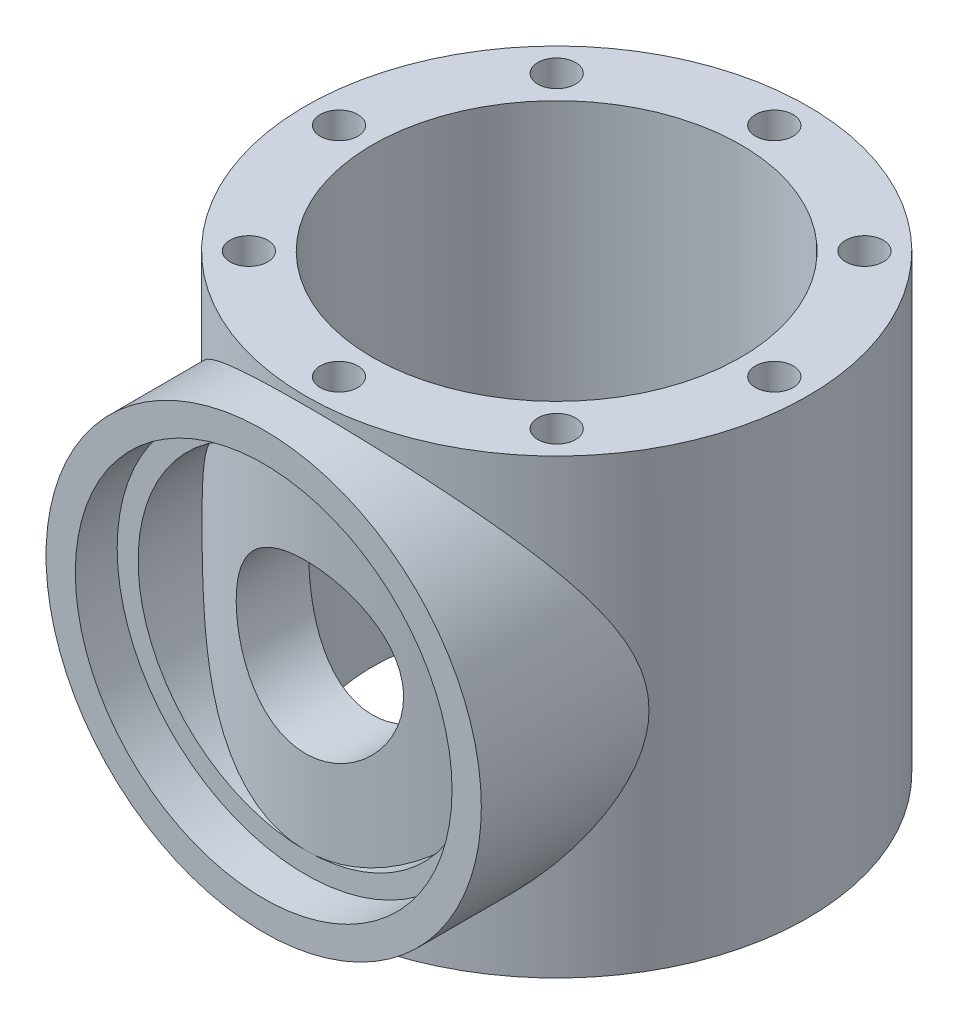
from build123d import *

# Parameters (mm, degrees)
SKETCH_1_R                 = 30
SKETCH_1_R_2               = 22
EXTRUDE_1_DEPTH            = 54
HOLE_WIZARD_M41_AT_2_COUNT = 2
HOLE_WIZARD_M41_AT_2_PITCH = 19.899538483
HOLE_WIZARD_M41_AT_3_COUNT = 2
HOLE_WIZARD_M41_AT_3_PITCH = 36.769552622
HOLE_WIZARD_M41_AT_4_COUNT = 2
HOLE_WIZARD_M41_AT_4_PITCH = 48.041735691
HOLE_WIZARD_M41_AT_5_COUNT = 2
HOLE_WIZARD_M41_AT_5_PITCH = 52
HOLE_WIZARD_M41_AT_6_COUNT = 2
HOLE_WIZARD_M41_AT_6_PITCH = 48.041735691
HOLE_WIZARD_M41_AT_7_COUNT = 2
HOLE_WIZARD_M41_AT_7_PITCH = 36.769552622
HOLE_WIZARD_M41_AT_8_COUNT = 2
HOLE_WIZARD_M41_AT_8_PITCH = 19.899538483
EXTRUDE_2_REACH            = 91.672
SKETCH_7_R                 = 26
SKETCH_7_R_2               = 20
SKETCH_9_R                 = 22.5
CUT_EXTRUDE_3_DEPTH        = 5
SKETCH_10_R                = 10
CUT_EXTRUDE_4_DEPTH        = 15


with BuildPart() as part:
    # Эскиз1 → Бобышка-Вытянуть1 (new body)
    with BuildSketch(Plane(origin=(0, 0, 0), x_dir=(1, 0, 0), z_dir=(0, 1, 0))):
        Circle(SKETCH_1_R)
        Circle(SKETCH_1_R_2, mode=Mode.SUBTRACT)
    extrude(amount=EXTRUDE_1_DEPTH)

    # Эскиз5 → Отверстие с зазором M41 (revolve, cut)
    with BuildSketch(Plane(origin=(-18.384776311, 54, -18.384776311), x_dir=(0, 0, 1), z_dir=(1, 0, 0))):
        Polygon((0, 0), (0, 13.351936393), (2.25, 12), (2.25, 0), align=None)
    hole_wizard_m41 = revolve(axis=Axis((-18.384776311, 60.35, -18.384776311), (0, -1, 0)), mode=Mode.SUBTRACT)

    # Отверстие с зазором M41 at 2: Отверстие с зазором M41 ×2
    with Locations(*[Vector(0.9238795325112705, 0, -0.38268343236512914) * (i * HOLE_WIZARD_M41_AT_2_PITCH) for i in range(1, HOLE_WIZARD_M41_AT_2_COUNT)]):
        add(hole_wizard_m41, mode=Mode.SUBTRACT)

    # Отверстие с зазором M41 at 3: Отверстие с зазором M41 ×2
    with Locations(*[(i * HOLE_WIZARD_M41_AT_3_PITCH, 0, 0) for i in range(1, HOLE_WIZARD_M41_AT_3_COUNT)]):
        add(hole_wizard_m41, mode=Mode.SUBTRACT)

    # Отверстие с зазором M41 at 4: Отверстие с зазором M41 ×2
    with Locations(*[Vector(0.9238795325113031, 0, 0.3826834323650504) * (i * HOLE_WIZARD_M41_AT_4_PITCH) for i in range(1, HOLE_WIZARD_M41_AT_4_COUNT)]):
        add(hole_wizard_m41, mode=Mode.SUBTRACT)

    # Отверстие с зазором M41 at 5: Отверстие с зазором M41 ×2
    with Locations(*[Vector(0.7071067811865778, 0, 0.7071067811865174) * (i * HOLE_WIZARD_M41_AT_5_PITCH) for i in range(1, HOLE_WIZARD_M41_AT_5_COUNT)]):
        add(hole_wizard_m41, mode=Mode.SUBTRACT)

    # Отверстие с зазором M41 at 6: Отверстие с зазором M41 ×2
    with Locations(*[Vector(0.38268343236512914, 0, 0.9238795325112705) * (i * HOLE_WIZARD_M41_AT_6_PITCH) for i in range(1, HOLE_WIZARD_M41_AT_6_COUNT)]):
        add(hole_wizard_m41, mode=Mode.SUBTRACT)

    # Отверстие с зазором M41 at 7: Отверстие с зазором M41 ×2
    with Locations(*[(0, 0, i * HOLE_WIZARD_M41_AT_7_PITCH) for i in range(1, HOLE_WIZARD_M41_AT_7_COUNT)]):
        add(hole_wizard_m41, mode=Mode.SUBTRACT)

    # Отверстие с зазором M41 at 8: Отверстие с зазором M41 ×2
    with Locations(*[Vector(-0.3826834323650503, 0, 0.9238795325113031) * (i * HOLE_WIZARD_M41_AT_8_PITCH) for i in range(1, HOLE_WIZARD_M41_AT_8_COUNT)]):
        add(hole_wizard_m41, mode=Mode.SUBTRACT)

    # Зеркальное отражение1: Отверстие с зазором M41 across plane
    add(hole_wizard_m41.mirror(Plane.ZX.offset(27)), mode=Mode.SUBTRACT)

    # Зеркальное отражение1 copy 1 sketch → Зеркальное отражение1 copy 1 (revolve, cut)
    with BuildSketch(Plane(origin=(0, 0, -26), x_dir=(0, 0, 1), z_dir=(1, 0, 0))):
        Polygon((0, 0), (0, -13.351936393), (2.25, -12), (2.25, 0), align=None)
    revolve(axis=Axis((0, -6.35, -26), (0, -1, 0)), mode=Mode.SUBTRACT)

    # Зеркальное отражение1 copy 2 sketch → Зеркальное отражение1 copy 2 (revolve, cut)
    with BuildSketch(Plane(origin=(18.384776311, 0, -18.384776311), x_dir=(0, 0, 1), z_dir=(1, 0, 0))):
        Polygon((0, 0), (0, -13.351936393), (2.25, -12), (2.25, 0), align=None)
    revolve(axis=Axis((18.384776311, -6.35, -18.384776311), (0, -1, 0)), mode=Mode.SUBTRACT)

    # Зеркальное отражение1 copy 3 sketch → Зеркальное отражение1 copy 3 (revolve, cut)
    with BuildSketch(Plane(origin=(26, 0, 0), x_dir=(0, 0, 1), z_dir=(1, 0, 0))):
        Polygon((0, 0), (0, -13.351936393), (2.25, -12), (2.25, 0), align=None)
    revolve(axis=Axis((26, -6.35, 0), (0, -1, 0)), mode=Mode.SUBTRACT)

    # Зеркальное отражение1 copy 4 sketch → Зеркальное отражение1 copy 4 (revolve, cut)
    with BuildSketch(Plane(origin=(18.384776311, 0, 18.384776311), x_dir=(0, 0, 1), z_dir=(1, 0, 0))):
        Polygon((0, 0), (0, -13.351936393), (2.25, -12), (2.25, 0), align=None)
    revolve(axis=Axis((18.384776311, -6.35, 18.384776311), (0, -1, 0)), mode=Mode.SUBTRACT)

    # Зеркальное отражение1 copy 5 sketch → Зеркальное отражение1 copy 5 (revolve, cut)
    with BuildSketch(Plane(origin=(0, 0, 26), x_dir=(0, 0, 1), z_dir=(1, 0, 0))):
        Polygon((0, 0), (0, -13.351936393), (2.25, -12), (2.25, 0), align=None)
    revolve(axis=Axis((0, -6.35, 26), (0, -1, 0)), mode=Mode.SUBTRACT)

    # Зеркальное отражение1 copy 6 sketch → Зеркальное отражение1 copy 6 (revolve, cut)
    with BuildSketch(Plane(origin=(-18.384776311, 0, 18.384776311), x_dir=(0, 0, 1), z_dir=(1, 0, 0))):
        Polygon((0, 0), (0, -13.351936393), (2.25, -12), (2.25, 0), align=None)
    revolve(axis=Axis((-18.384776311, -6.35, 18.384776311), (0, -1, 0)), mode=Mode.SUBTRACT)

    # Зеркальное отражение1 copy 7 sketch → Зеркальное отражение1 copy 7 (revolve, cut)
    with BuildSketch(Plane(origin=(-26, 0, 0), x_dir=(0, 0, 1), z_dir=(1, 0, 0))):
        Polygon((0, 0), (0, -13.351936393), (2.25, -12), (2.25, 0), align=None)
    revolve(axis=Axis((-26, -6.35, 0), (0, -1, 0)), mode=Mode.SUBTRACT)

    # Эскиз7 → Бобышка-Вытянуть2 (add, up to next)
    with BuildSketch(Plane.XY.offset(35), mode=Mode.PRIVATE) as extrude_2_sk1:
        with Locations((0, 27)):
            Circle(SKETCH_7_R)
        with Locations((0, 27)):
            Circle(SKETCH_7_R_2, mode=Mode.SUBTRACT)
    extrude_2_tool1 = extrude(extrude_2_sk1.sketch, amount=-EXTRUDE_2_REACH, mode=Mode.PRIVATE) - part.part
    add(extrude_2_tool1.solids().sort_by_distance((-25.264609, 27, 35))[0])

    # Эскиз9 → Вырез-Вытянуть3 (cut)
    with BuildSketch(Plane.XY.offset(35)):
        with Locations((0, 27)):
            Circle(SKETCH_9_R)
    extrude(amount=-CUT_EXTRUDE_3_DEPTH, mode=Mode.SUBTRACT)

    # Эскиз10 → Вырез-Вытянуть4 (cut)
    with BuildSketch(Plane.XY.offset(30)):
        with Locations((0, 27)):
            Circle(SKETCH_10_R)
    extrude(amount=-CUT_EXTRUDE_4_DEPTH, mode=Mode.SUBTRACT)


solid = part.part
